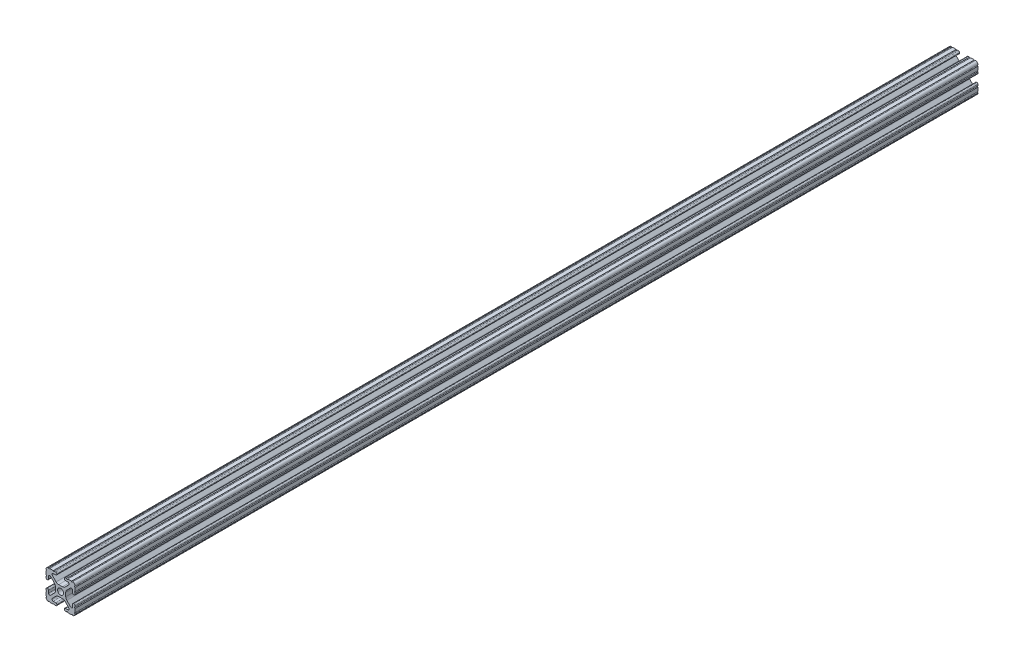
from build123d import *

# Parameters (mm, degrees)
SKETCH1_R               = 2.6035
BOSS_EXTRUDE1_DEPTH     = 393.7
CUT_EXTRUDE1_DEPTH      = 395.280499736
CUT_EXTRUDE1_DEPTH_BACK = 395.280499736
SKETCH2_R               = 3.175


with BuildPart() as part:
    # Sketch1 → Boss-Extrude1 (new, symmetric)
    with BuildSketch(Plane.XY):
        with BuildLine():
            Line((-7.179650497, -8.645192506), (-3.952270251, -5.423690499))
            ThreePointArc((-3.952270251, -5.423690499), (-2.922936451, -4.736929036), (-1.709253557, -4.4958))
            Line((-1.709253557, -4.4958), (1.709253557, -4.4958))
            ThreePointArc((1.709253557, -4.4958), (2.922936451, -4.736929036), (3.952270251, -5.423690499))
            Line((3.952270251, -5.423690499), (7.179650497, -8.645192506))
            ThreePointArc((7.179650497, -8.645192506), (7.41473083, -9.822813117), (6.416408329, -10.4902))
            Line((6.416408329, -10.4902), (4.287512407, -10.4902))
            ThreePointArc((4.287512407, -10.4902), (3.54574862, -10.79744862), (3.2385, -11.539212407))
            Line((3.2385, -11.539212407), (3.2385, -11.650987593))
            ThreePointArc((3.2385, -11.650987593), (3.54574862, -12.39275138), (4.287512407, -12.7))
            Line((4.287512407, -12.7), (5.317126718, -12.7))
            ThreePointArc((5.317126718, -12.7), (5.825126718, -12.192), (6.333126718, -12.7))
            Line((6.333126718, -12.7), (9.550443118, -12.7))
            ThreePointArc((9.550443118, -12.7), (10.058366869, -12.192000006), (10.566443095, -12.699847501))
            ThreePointArc((10.566443095, -12.699847501), (12.082537762, -12.08250727), (12.699846982, -10.566399977))
            ThreePointArc((12.699846982, -10.566399977), (12.192000006, -10.058323491), (12.7, -9.5504))
            Line((12.7, -9.5504), (12.7, -6.3330836))
            ThreePointArc((12.7, -6.3330836), (12.192, -5.8250836), (12.7, -5.3170836))
            Line((12.7, -5.3170836), (12.7, -4.287469289))
            ThreePointArc((12.7, -4.287469289), (12.39275138, -3.545705502), (11.650987593, -3.238456882))
            Line((11.650987593, -3.238456882), (11.539212407, -3.238456882))
            ThreePointArc((11.539212407, -3.238456882), (10.79744862, -3.545705502), (10.4902, -4.287469289))
            Line((10.4902, -4.287469289), (10.4902, -6.402089023))
            ThreePointArc((10.4902, -6.402089023), (9.856505071, -7.351067942), (8.737131347, -7.129408934))
            Line((8.737131347, -7.129408934), (5.441005833, -3.840816462))
            ThreePointArc((5.441005833, -3.840816462), (4.750877967, -2.809883091), (4.5085, -1.593185507))
            Line((4.5085, -1.593185507), (4.5085, 1.593185507))
            ThreePointArc((4.5085, 1.593185507), (4.750877967, 2.809883091), (5.441005833, 3.840816462))
            Line((5.441005833, 3.840816462), (8.737131347, 7.129408934))
            ThreePointArc((8.737131347, 7.129408934), (9.856505071, 7.351067942), (10.4902, 6.402089023))
            Line((10.4902, 6.402089023), (10.4902, 4.287469289))
            ThreePointArc((10.4902, 4.287469289), (10.79744862, 3.545705502), (11.539212407, 3.238456882))
            Line((11.539212407, 3.238456882), (11.650987593, 3.238456882))
            ThreePointArc((11.650987593, 3.238456882), (12.39275138, 3.545705502), (12.7, 4.287469289))
            Line((12.7, 4.287469289), (12.7, 5.3170836))
            ThreePointArc((12.7, 5.3170836), (12.192, 5.8250836), (12.7, 6.3330836))
            Line((12.7, 6.3330836), (12.7, 9.5504))
            ThreePointArc((12.7, 9.5504), (12.192000006, 10.058323491), (12.699846982, 10.566399977))
            ThreePointArc((12.699846982, 10.566399977), (12.082537762, 12.08250727), (10.566443095, 12.699847501))
            ThreePointArc((10.566443095, 12.699847501), (10.058366869, 12.192000006), (9.550443118, 12.7))
            Line((9.550443118, 12.7), (6.333126718, 12.7))
            ThreePointArc((6.333126718, 12.7), (5.825126718, 12.192), (5.317126718, 12.7))
            Line((5.317126718, 12.7), (4.287512407, 12.7))
            ThreePointArc((4.287512407, 12.7), (3.54574862, 12.39275138), (3.2385, 11.650987593))
            Line((3.2385, 11.650987593), (3.2385, 11.539212407))
            ThreePointArc((3.2385, 11.539212407), (3.54574862, 10.79744862), (4.287512407, 10.4902))
            Line((4.287512407, 10.4902), (6.476788598, 10.4902))
            ThreePointArc((6.476788598, 10.4902), (7.432222385, 9.85140422), (7.207036008, 8.724370562))
            Line((7.207036008, 8.724370562), (3.898272566, 5.423169045))
            ThreePointArc((3.898272566, 5.423169045), (2.869120213, 4.736787962), (1.655778399, 4.4958))
            Line((1.655778399, 4.4958), (-1.655778399, 4.4958))
            ThreePointArc((-1.655778399, 4.4958), (-2.869120213, 4.736787962), (-3.898272566, 5.423169045))
            Line((-3.898272566, 5.423169045), (-7.207036008, 8.724370562))
            ThreePointArc((-7.207036008, 8.724370562), (-7.432222385, 9.85140422), (-6.476788598, 10.4902))
            Line((-6.476788598, 10.4902), (-4.287512407, 10.4902))
            ThreePointArc((-4.287512407, 10.4902), (-3.54574862, 10.79744862), (-3.2385, 11.539212407))
            Line((-3.2385, 11.539212407), (-3.2385, 11.650987593))
            ThreePointArc((-3.2385, 11.650987593), (-3.54574862, 12.39275138), (-4.287512407, 12.7))
            Line((-4.287512407, 12.7), (-5.317126718, 12.7))
            ThreePointArc((-5.317126718, 12.7), (-5.825126718, 12.192), (-6.333126718, 12.7))
            Line((-6.333126718, 12.7), (-9.550443118, 12.7))
            ThreePointArc((-9.550443118, 12.7), (-10.058366869, 12.192000006), (-10.566443095, 12.699847501))
            ThreePointArc((-10.566443095, 12.699847501), (-12.082537762, 12.08250727), (-12.699846982, 10.566399977))
            ThreePointArc((-12.699846982, 10.566399977), (-12.192000006, 10.058323491), (-12.7, 9.5504))
            Line((-12.7, 9.5504), (-12.7, 6.3330836))
            ThreePointArc((-12.7, 6.3330836), (-12.192, 5.8250836), (-12.7, 5.3170836))
            Line((-12.7, 5.3170836), (-12.7, 4.287469289))
            ThreePointArc((-12.7, 4.287469289), (-12.39275138, 3.545705502), (-11.650987593, 3.238456882))
            Line((-11.650987593, 3.238456882), (-11.539212407, 3.238456882))
            ThreePointArc((-11.539212407, 3.238456882), (-10.79744862, 3.545705502), (-10.4902, 4.287469289))
            Line((-10.4902, 4.287469289), (-10.4902, 6.402089023))
            ThreePointArc((-10.4902, 6.402089023), (-9.856505071, 7.351067942), (-8.737131347, 7.129408934))
            Line((-8.737131347, 7.129408934), (-5.441005833, 3.840816462))
            ThreePointArc((-5.441005833, 3.840816462), (-4.750877967, 2.809883091), (-4.5085, 1.593185507))
            Line((-4.5085, 1.593185507), (-4.5085, -1.593185507))
            ThreePointArc((-4.5085, -1.593185507), (-4.750877967, -2.809883091), (-5.441005833, -3.840816462))
            Line((-5.441005833, -3.840816462), (-8.737131347, -7.129408934))
            ThreePointArc((-8.737131347, -7.129408934), (-9.856505071, -7.351067942), (-10.4902, -6.402089023))
            Line((-10.4902, -6.402089023), (-10.4902, -4.287469289))
            ThreePointArc((-10.4902, -4.287469289), (-10.79744862, -3.545705502), (-11.539212407, -3.238456882))
            Line((-11.539212407, -3.238456882), (-11.650987593, -3.238456882))
            ThreePointArc((-11.650987593, -3.238456882), (-12.39275138, -3.545705502), (-12.7, -4.287469289))
            Line((-12.7, -4.287469289), (-12.7, -5.3170836))
            ThreePointArc((-12.7, -5.3170836), (-12.192, -5.8250836), (-12.7, -6.3330836))
            Line((-12.7, -6.3330836), (-12.7, -9.5504))
            ThreePointArc((-12.7, -9.5504), (-12.192000006, -10.058323491), (-12.699846982, -10.566399977))
            ThreePointArc((-12.699846982, -10.566399977), (-12.082537762, -12.08250727), (-10.566443095, -12.699847501))
            ThreePointArc((-10.566443095, -12.699847501), (-10.058366869, -12.192000006), (-9.550443118, -12.7))
            Line((-9.550443118, -12.7), (-6.333126718, -12.7))
            ThreePointArc((-6.333126718, -12.7), (-5.825126718, -12.192), (-5.317126718, -12.7))
            Line((-5.317126718, -12.7), (-4.287512407, -12.7))
            ThreePointArc((-4.287512407, -12.7), (-3.54574862, -12.39275138), (-3.2385, -11.650987593))
            Line((-3.2385, -11.650987593), (-3.2385, -11.539212407))
            ThreePointArc((-3.2385, -11.539212407), (-3.54574862, -10.79744862), (-4.287512407, -10.4902))
            Line((-4.287512407, -10.4902), (-6.416408329, -10.4902))
            ThreePointArc((-6.416408329, -10.4902), (-7.41473083, -9.822813117), (-7.179650497, -8.645192506))
        make_face()
        Circle(SKETCH1_R, mode=Mode.SUBTRACT)
    extrude(amount=BOSS_EXTRUDE1_DEPTH, both=True)

    # Sketch2 → Cut-Extrude1 (cut, two sides: drawn at the far end of the back side and taken through both)
    with BuildSketch(Plane(origin=(4.5085, 0, 0), x_dir=(0, 0, -1), z_dir=(1, 0, 0)).offset(-CUT_EXTRUDE1_DEPTH_BACK)):
        with Locations((-279.4, 0)):
            Circle(SKETCH2_R)
        with Locations((279.4, 0)):
            Circle(SKETCH2_R)
        with Locations((-12.7, 0)):
            Circle(SKETCH2_R)
        with Locations((12.7, 0)):
            Circle(SKETCH2_R)
    extrude(amount=CUT_EXTRUDE1_DEPTH + CUT_EXTRUDE1_DEPTH_BACK, mode=Mode.SUBTRACT)


solid = part.part
